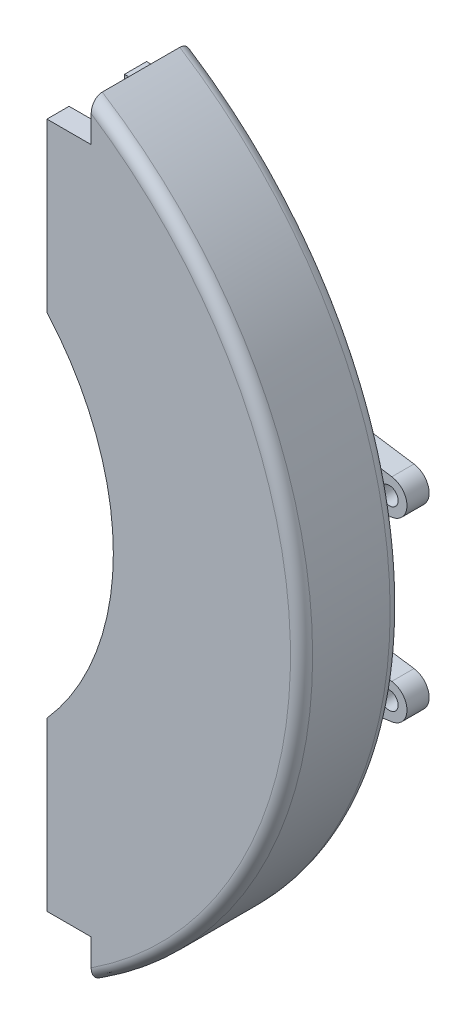
from build123d import *

# Parameters (mm, degrees)
BOSS_EXTRUDE1_DEPTH  = 22.5
BOSS_EXTRUDE11_DEPTH = 15.000000000000007
BOSS_EXTRUDE12_DEPTH = 10.000000000000002
SKETCH17_W           = 16.30093206343537
SKETCH17_H           = 28.65243434652365
CUT_EXTRUDE3_DEPTH   = 10.000000000000002
SKETCH18_R           = 10.016796709236138
BOSS_EXTRUDE13_DEPTH = 4
BOSS_EXTRUDE14_DEPTH = 7
SKETCH20_W           = 19.468642499915788
SKETCH20_H           = 12.372252056489486
CUT_EXTRUDE4_DEPTH   = 7
SHELL1_T             = -10
FILLET2_R            = 16
BOSS_EXTRUDE16_DEPTH = 7
FILLET5_R            = 5
SKETCH27_R           = 3.9999999999999933
SKETCH27_R_2         = 4.000000000000007
CUT_EXTRUDE6_DEPTH   = 276.7682139586702
SPLIT2_START         = -37.5
SPLIT2_DEPTH         = 15
SPLIT2_START_2       = -32.5
SPLIT2_2_OUTLINE_R   = 4
SPLIT2_2_DEPTH       = 10
SPLIT2_START_3       = -27.5
SPLIT2_3_OUTLINE_W   = 19.4686425
SPLIT2_3_OUTLINE_H   = 12.372252056000008
SPLIT2_3_OUTLINE_R   = 4
SPLIT2_3_DEPTH       = 5
SPLIT2_START_4       = -30.5
SPLIT2_4_OUTLINE_W   = 19.4686425
SPLIT2_4_OUTLINE_H   = 12.372252056000008
SPLIT2_4_OUTLINE_R   = 4
SPLIT2_4_DEPTH       = 3
SPLIT2_5_OUTLINE_R   = 4
SPLIT2_5_DEPTH       = 15
SPLIT2_START_5       = -55
SPLIT2_6_OUTLINE_R   = 10.016796709
SPLIT2_6_DEPTH       = 17.5
SPLIT2_START_6       = -48.5
SPLIT2_7_DEPTH       = 11
SPLIT2_START_7       = -41.5
SPLIT2_8_OUTLINE_R   = 10.016796709
SPLIT2_8_DEPTH       = 4


with BuildPart() as part:
    # Sketch2 → Boss-Extrude1 (new, symmetric)
    with BuildSketch(Plane.XY):
        with BuildLine():
            Line((120, 0), (205.00000000000003, 0))
            ThreePointArc((205.00000000000003, 0), (179.6872282606641, 98.67877177995278), (109.99999999999999, 172.98843892006195))
            Line((109.99999999999999, 172.98843892006195), (109.99999999999999, 154.91933384829673))
            Line((109.99999999999999, 154.91933384829673), (90, 154.91933384829673))
            Line((90, 154.91933384829673), (90, 79.37253933193772))
            ThreePointArc((90, 79.37253933193772), (112.24972160321823, 42.426406871192846), (120, 0))
        make_face()
    extrude(amount=BOSS_EXTRUDE1_DEPTH, both=True)

    # Sketch15 → Boss-Extrude11 (add)
    with BuildSketch(Plane(origin=(0, 0, -22.5), x_dir=(-1, 0, 0), z_dir=(0, 0, -1))):
        Polygon((-90, 102.85535609908183), (-109.46864249991577, 102.85535609908183), (-109.46864249991577, 126.1310181234055), (-135.96708849683807, 126.1310181234055), (-135.96708849683807, 84.23482647962292), (-159.60083762922824, 57.736380482700625), (-159.60083762922824, 19.77914702764976), (-171.0596250873568, 19.77914702764976), (-171.05962508735678, -1.73e-15), (-124.19597171575583, 0), (-124.19597171575583, 55.24390413047252), (-109.46864249991577, 55.24390413047252), (-109.46864249991577, 90.48310404259234), (-90, 90.48310404259234), align=None)
    extrude(amount=BOSS_EXTRUDE11_DEPTH)

    # Sketch16 → Boss-Extrude12 (add)
    with BuildSketch(Plane(origin=(0, 0, -22.5), x_dir=(-1, 0, 0), z_dir=(0, 0, -1))):
        with BuildLine():
            Line((-159.60083762922824, 26.000000000000004), (-200.770736325474, 32.08600372501209))
            ThreePointArc((-200.770736325474, 32.08600372501209), (-207.60083762922824, 39.99999999999999), (-200.770736325474, 47.913996274987895))
            Line((-200.770736325474, 47.913996274987895), (-159.60083762922824, 54))
            Line((-159.60083762922824, 54), (-159.60083762922824, 26.000000000000004))
        make_face()
    extrude(amount=BOSS_EXTRUDE12_DEPTH)

    # Sketch17 → Cut-Extrude3 (cut)
    with BuildSketch(Plane(origin=(0, 0, -37.50000000000001), x_dir=(-1, 0, 0), z_dir=(0, 0, -1))):
        with Locations((-127.81662246512039, 111.80480095014369)):
            Rectangle(SKETCH17_W, SKETCH17_H)
    extrude(amount=-CUT_EXTRUDE3_DEPTH, mode=Mode.SUBTRACT)

    # Sketch18 → Boss-Extrude13 (add)
    with BuildSketch(Plane(origin=(0, 0, -37.50000000000001), x_dir=(-1, 0, 0), z_dir=(0, 0, -1))):
        with Locations((-142.54790687329097, 47.73221762561834)):
            Circle(SKETCH18_R)
    extrude(amount=BOSS_EXTRUDE13_DEPTH)

    # Sketch19 → Boss-Extrude14 (add)
    with BuildSketch(Plane(origin=(0, 0, -41.50000000000001), x_dir=(-1, 0, 0), z_dir=(0, 0, -1))):
        Polygon((-142.54790687329097, 56.421959954505496), (-150.0734444824482, 52.0770887900619), (-150.07344448244817, 43.38734646117473), (-142.5479068732909, 39.04247529673119), (-135.0223692641337, 43.387346461174836), (-135.0223692641338, 52.07708879006201), align=None)
    extrude(amount=BOSS_EXTRUDE14_DEPTH)

    # Dome2: read off the stored shape, not the designer's step
    # Dome2 outline → Dome2 (revolve)
    with BuildSketch(Plane(origin=(142.547906873, 47.732217626, 0), x_dir=(1, 0, 0), z_dir=(0, -1, 0))):
        with BuildLine():
            Line((0, -48.499999993), (0, -54.5))
            ThreePointArc((0, -54.5), (4.609772231, -52.794734264), (7.000000001, -48.499999993))
            Line((7.000000001, -48.499999993), (0, -48.499999993))
        make_face()
    revolve(axis=Axis((142.547906873, 47.732217626, 0), (0, 0, 1)))

    # Sketch20 → Cut-Extrude4 (cut)
    with BuildSketch(Plane(origin=(0, 0, -37.50000000000001), x_dir=(-1, 0, 0), z_dir=(0, 0, -1))):
        with Locations((-99.7343212499579, 96.66923007083709)):
            Rectangle(SKETCH20_W, SKETCH20_H)
    extrude(amount=-CUT_EXTRUDE4_DEPTH, mode=Mode.SUBTRACT)


with BuildPart() as body_2:
    # Split1: read off the stored shape, not the designer's step
    # Split1: the piece on the far side of the plane
    add(part.part)
    split(bisect_by=Plane.XY.offset(-22.5), keep=Keep.BOTTOM)

    # Fillet2
    fillet2_edges = [body_2.edges().sort_by_distance(p)[0] for p in [
        (135.96708849683807, 126.1310181234055, -25.000000000000004),
    ]]
    fillet(fillet2_edges, radius=FILLET2_R)


with BuildPart() as part_1:
    add(part.part)

    # Split1
    split(bisect_by=Plane.XY.offset(-22.5), keep=Keep.TOP)

    # Shell1
    shell1_openings = [part_1.faces().sort_by_distance(p)[0] for p in [
        (90, 117.14593659, 0),
        (112.249721603, 42.426406871, 0),
        (162.5, 0, 0),
        (110, 163.953886384, 0),
        (100, 154.919333848, 0),
    ]]
    offset(amount=SHELL1_T, openings=shell1_openings)


with BuildPart() as body_3:
    # Mirror2: mirrored copy
    add(part_1.part.mirror(Plane(origin=(120, 0, 22.5), x_dir=(0, 0, 1), z_dir=(0, 1, 0))))

    # Combine2: union part
    add(part_1.part)

    # Fillet5
    fillet5_edges = [body_3.edges().sort_by_distance(p)[0] for p in [
        (205, -3.55e-15, -22.5),
        (205, -3.55e-15, 22.5),
    ]]
    fillet(fillet5_edges, radius=FILLET5_R)


with BuildPart() as body_4:
    # Mirror2 2: mirrored copy
    add(body_2.part.mirror(Plane(origin=(120, 0, 22.5), x_dir=(0, 0, 1), z_dir=(0, 1, 0))))

    # Combine1: union body 2
    add(body_2.part)


with BuildPart() as body_4_2:
    # Sketch23 → Boss-Extrude16 (new body)
    with BuildSketch(Plane(origin=(0, 0, -30.500000000000007), x_dir=(-1, 0, 0), z_dir=(0, 0, -1))):
        with BuildLine():
            Line((-93.49999999999997, 95), (-93.49999999999997, -95))
            ThreePointArc((-93.49999999999997, -95), (-98.99999999999996, -100.50000000000001), (-104.49999999999997, -95))
            Line((-104.49999999999997, -95), (-104.49999999999997, 95))
            ThreePointArc((-104.49999999999997, 95), (-98.99999999999996, 100.49999999999999), (-93.49999999999997, 95))
        make_face()
    extrude(amount=BOSS_EXTRUDE16_DEPTH)


with BuildPart() as cut_extrude6_tool:
    # Sketch27 → Cut-Extrude6 (new, through all)
    with BuildSketch(Plane(origin=(0, 0, -32.5), x_dir=(-1, 0, 0), z_dir=(0, 0, -1))):
        with Locations((-199.60083762922824, 39.99999999999999)):
            Circle(SKETCH27_R)
        with Locations((-199.60083762922824, -39.99999999999999)):
            Circle(SKETCH27_R)
        with Locations((-98.99999999999996, 95)):
            Circle(SKETCH27_R_2)
        with Locations((-98.99999999999996, -95)):
            Circle(SKETCH27_R_2)
    extrude(amount=-CUT_EXTRUDE6_DEPTH)


with BuildPart() as body_4_1:
    add(body_4.part)

    # Cut-Extrude6: cut by cut_extrude6_tool
    add(cut_extrude6_tool.part, mode=Mode.SUBTRACT)

    # Split2 5 outline → Split2 5 (cut)
    with BuildSketch(Plane.XY.offset(SPLIT2_START)):
        with BuildLine():
            Line((109.4686425, -55.24390413), (109.4686425, -90.483104043))
            Line((109.4686425, -90.483104043), (90, -90.483104043))
            Line((90, -90.483104043), (90, -102.855356099))
            Line((90, -102.855356099), (109.4686425, -102.855356099))
            Line((109.4686425, -102.855356099), (109.4686425, -126.131018123))
            Line((109.4686425, -126.131018123), (119.967088497, -126.131018123))
            ThreePointArc((119.967088497, -126.131018123), (131.280796996, -121.444726622), (135.967088497, -110.131018123))
            Line((135.967088497, -110.131018123), (135.967088497, -84.23482648))
            Line((135.967088497, -84.23482648), (159.600837629, -57.736380483))
            Line((159.600837629, -57.736380483), (159.600837629, -54))
            Line((159.600837629, -54), (200.770736325, -47.913996275))
            ThreePointArc((200.770736325, -47.913996275), (207.600837629, -40), (200.770736325, -32.086003725))
            Line((200.770736325, -32.086003725), (159.600837629, -26))
            Line((159.600837629, -26), (159.600837629, -19.779147028))
            Line((159.600837629, -19.779147028), (171.059625087, -19.779147028))
            Line((171.059625087, -19.779147028), (171.059625087, 19.779147028))
            Line((171.059625087, 19.779147028), (159.600837629, 19.779147028))
            Line((159.600837629, 19.779147028), (159.600837629, 26))
            Line((159.600837629, 26), (200.770736325, 32.086003725))
            ThreePointArc((200.770736325, 32.086003725), (207.600837629, 40), (200.770736325, 47.913996275))
            Line((200.770736325, 47.913996275), (159.600837629, 54))
            Line((159.600837629, 54), (159.600837629, 57.736380483))
            Line((159.600837629, 57.736380483), (135.967088497, 84.23482648))
            Line((135.967088497, 84.23482648), (135.967088497, 110.131018123))
            ThreePointArc((135.967088497, 110.131018123), (131.280796996, 121.444726622), (119.967088497, 126.131018123))
            Line((119.967088497, 126.131018123), (109.4686425, 126.131018123))
            Line((109.4686425, 126.131018123), (109.4686425, 102.855356099))
            Line((109.4686425, 102.855356099), (90, 102.855356099))
            Line((90, 102.855356099), (90, 90.483104043))
            Line((90, 90.483104043), (109.4686425, 90.483104043))
            Line((109.4686425, 90.483104043), (109.4686425, 55.24390413))
            Line((109.4686425, 55.24390413), (124.195971716, 55.24390413))
            Line((124.195971716, 55.24390413), (124.195971716, -55.24390413))
            Line((124.195971716, -55.24390413), (109.4686425, -55.24390413))
        make_face()
        with Locations((99, -95)):
            Circle(SPLIT2_5_OUTLINE_R, mode=Mode.SUBTRACT)
        with Locations((99, 95)):
            Circle(SPLIT2_5_OUTLINE_R, mode=Mode.SUBTRACT)
        with Locations((199.600837629, 40)):
            Circle(SPLIT2_5_OUTLINE_R, mode=Mode.SUBTRACT)
        with Locations((199.600837629, -40)):
            Circle(SPLIT2_5_OUTLINE_R, mode=Mode.SUBTRACT)
    extrude(amount=SPLIT2_5_DEPTH, mode=Mode.SUBTRACT)

    # Split2 6 outline → Split2 6 (cut)
    with BuildSketch(Plane.XY.offset(SPLIT2_START_5)):
        with Locations((142.547906873, 47.732217626)):
            Circle(SPLIT2_6_OUTLINE_R)
    extrude(amount=SPLIT2_6_DEPTH, mode=Mode.SUBTRACT)


with BuildPart() as body_4_2_1:
    add(body_4_2.part)

    # Cut-Extrude6: cut by cut_extrude6_tool
    add(cut_extrude6_tool.part, mode=Mode.SUBTRACT)


with BuildPart() as body_4_3:
    # Split2: read off the stored shape, not the designer's step
    # Split2 outline → Split2 (new body)
    with BuildSketch(Plane.XY.offset(SPLIT2_START)):
        Polygon((109.4686425, -55.24390413), (109.4686425, -126.131018123), (119.666156433, -126.131018123), (119.666156433, -97.478583777), (135.967088497, -97.478583777), (135.967088497, -84.23482648), (159.600837629, -57.736380483), (159.600837629, -19.779147028), (171.059625087, -19.779147028), (171.059625087, 19.779147028), (159.600837629, 19.779147028), (159.600837629, 57.736380483), (135.967088497, 84.23482648), (135.967088497, 97.478583777), (119.666156433, 97.478583777), (119.666156433, 126.131018123), (109.4686425, 126.131018123), (109.4686425, 55.24390413), (124.195971716, 55.24390413), (124.195971716, -55.24390413), align=None)
    extrude(amount=SPLIT2_DEPTH)

    # Split2 2 outline → Split2 2 (add)
    # profile 1 of 2: a face of its own
    with BuildSketch(Plane.XY.offset(SPLIT2_START_2)):
        with BuildLine():
            Line((159.600837629, -26), (159.600837629, -54))
            Line((159.600837629, -54), (200.770736325, -47.913996275))
            ThreePointArc((200.770736325, -47.913996275), (207.600837629, -40), (200.770736325, -32.086003725))
            Line((200.770736325, -32.086003725), (159.600837629, -26))
        make_face()
        with Locations((199.600837629, -40)):
            Circle(SPLIT2_2_OUTLINE_R, mode=Mode.SUBTRACT)
    # profile 2 of 2: a face of its own
    with BuildSketch(Plane.XY.offset(SPLIT2_START_2)):
        with BuildLine():
            Line((159.600837629, 54), (159.600837629, 26))
            Line((159.600837629, 26), (200.770736325, 32.086003725))
            ThreePointArc((200.770736325, 32.086003725), (207.600837629, 40), (200.770736325, 47.913996275))
            Line((200.770736325, 47.913996275), (159.600837629, 54))
        make_face()
        with Locations((199.600837629, 40)):
            Circle(SPLIT2_2_OUTLINE_R, mode=Mode.SUBTRACT)
    extrude(amount=SPLIT2_2_DEPTH)

    # Split2 3 outline → Split2 3 (add)
    # profile 1 of 4: a face of its own
    with BuildSketch(Plane.XY.offset(SPLIT2_START_3)):
        with Locations((99.73432125, -96.669230071)):
            Rectangle(SPLIT2_3_OUTLINE_W, SPLIT2_3_OUTLINE_H)
        with Locations((99, -95)):
            Circle(SPLIT2_3_OUTLINE_R, mode=Mode.SUBTRACT)
    # profile 2 of 4: a face of its own
    with BuildSketch(Plane.XY.offset(SPLIT2_START_3)):
        with BuildLine():
            Line((119.666156433, -97.478583777), (119.666156433, -126.131018123))
            Line((119.666156433, -126.131018123), (119.967088497, -126.131018123))
            ThreePointArc((119.967088497, -126.131018123), (131.280796996, -121.444726622), (135.967088497, -110.131018123))
            Line((135.967088497, -110.131018123), (135.967088497, -97.478583777))
            Line((135.967088497, -97.478583777), (119.666156433, -97.478583777))
        make_face()
    # profile 3 of 4: a face of its own
    with BuildSketch(Plane.XY.offset(SPLIT2_START_3)):
        with Locations((99.73432125, 96.669230071)):
            Rectangle(SPLIT2_3_OUTLINE_W, SPLIT2_3_OUTLINE_H)
        with Locations((99, 95)):
            Circle(SPLIT2_3_OUTLINE_R, mode=Mode.SUBTRACT)
    # profile 4 of 4: a face of its own
    with BuildSketch(Plane.XY.offset(SPLIT2_START_3)):
        with BuildLine():
            Line((119.967088497, 126.131018123), (119.666156433, 126.131018123))
            Line((119.666156433, 126.131018123), (119.666156433, 97.478583777))
            Line((119.666156433, 97.478583777), (135.967088497, 97.478583777))
            Line((135.967088497, 97.478583777), (135.967088497, 110.131018123))
            ThreePointArc((135.967088497, 110.131018123), (131.280796996, 121.444726622), (119.967088497, 126.131018123))
        make_face()
    extrude(amount=SPLIT2_3_DEPTH)

    # Split2 4 outline → Split2 4 (add)
    # profile 1 of 2: a face of its own
    with BuildSketch(Plane.XY.offset(SPLIT2_START_4)):
        with Locations((99.73432125, -96.669230071)):
            Rectangle(SPLIT2_4_OUTLINE_W, SPLIT2_4_OUTLINE_H)
        with Locations((99, -95)):
            Circle(SPLIT2_4_OUTLINE_R, mode=Mode.SUBTRACT)
    # profile 2 of 2: a face of its own
    with BuildSketch(Plane.XY.offset(SPLIT2_START_4)):
        with Locations((99.73432125, 96.669230071)):
            Rectangle(SPLIT2_4_OUTLINE_W, SPLIT2_4_OUTLINE_H)
        with Locations((99, 95)):
            Circle(SPLIT2_4_OUTLINE_R, mode=Mode.SUBTRACT)
    extrude(amount=SPLIT2_4_DEPTH)


with BuildPart() as body_5:
    # Split2 7 outline → Split2 7 (new body)
    with BuildSketch(Plane.XY.offset(SPLIT2_START_6)):
        Polygon((150.073444482, 43.387346461), (150.073444482, 52.07708879), (142.547906873, 56.421959955), (135.022369264, 52.07708879), (135.022369264, 43.387346461), (142.547906873, 39.042475297), align=None)
    extrude(amount=SPLIT2_7_DEPTH)

    # Split2 8 outline → Split2 8 (add)
    with BuildSketch(Plane.XY.offset(SPLIT2_START_7)):
        with Locations((142.547906873, 47.732217626)):
            Circle(SPLIT2_8_OUTLINE_R)
        Polygon((142.547906873, 56.421959955), (150.073444482, 52.07708879), (150.073444482, 43.387346461), (142.547906873, 39.042475297), (135.022369264, 43.387346461), (135.022369264, 52.07708879), align=None, mode=Mode.SUBTRACT)
    extrude(amount=SPLIT2_8_DEPTH)

    # Split2 9 outline → Split2 9 (revolve)
    with BuildSketch(Plane(origin=(142.547906873, 47.732217626, 0), x_dir=(1, 0, 0), z_dir=(0, -1, 0))):
        with BuildLine():
            Line((0, -48.499999993), (0, -54.5))
            ThreePointArc((0, -54.5), (4.609772231, -52.794734264), (7.000000001, -48.499999993))
            Line((7.000000001, -48.499999993), (0, -48.499999993))
        make_face()
    revolve(axis=Axis((142.547906873, 47.732217626, 0), (0, 0, 1)))


solid = Compound([body_3.part, body_4_1.part, body_4_2_1.part, body_4_3.part, body_5.part])
